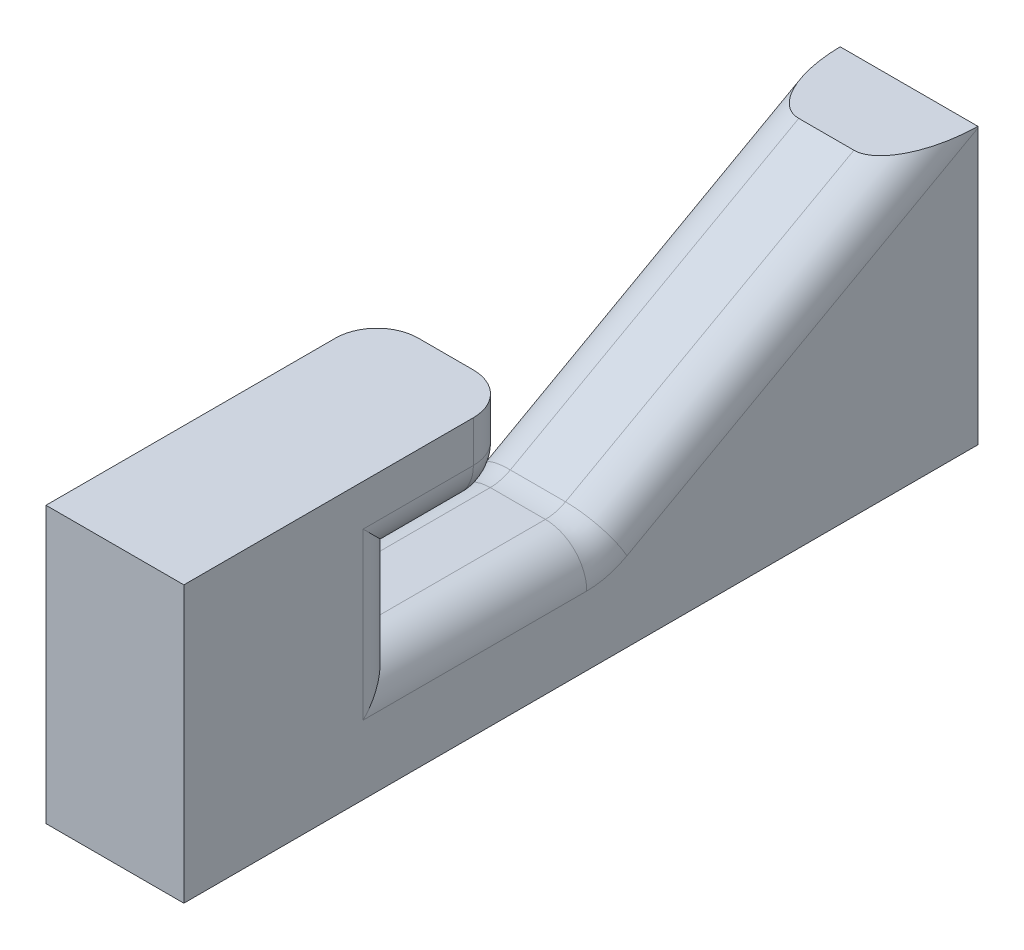
from build123d import *

# Parameters (mm, degrees)
SKETCH2_W           = 10
SKETCH2_H           = 28.8
BOSS_EXTRUDE1_DEPTH = 5
CUT_EXTRUDE1_DEPTH  = 31.894012365
FILLET2_R           = 1.5


with BuildPart() as part:
    # Sketch2 → Boss-Extrude1 (new body)
    with BuildSketch(Plane.YZ):
        with Locations((5, 14.4)):
            Rectangle(SKETCH2_W, SKETCH2_H)
    extrude(amount=BOSS_EXTRUDE1_DEPTH)

    # Sketch3 → Cut-Extrude1 (cut, through all)
    with BuildSketch(Plane.YZ.offset(5)):
        Polygon((10, 16.8), (7, 16.8), (7, 20.8), (4, 20.8), (4, 13.8), (10, 3), align=None)
    extrude(amount=-CUT_EXTRUDE1_DEPTH, mode=Mode.SUBTRACT)

    # Fillet2
    fillet2_edges = [part.edges().sort_by_distance(p)[0] for p in [
        (2.5, 7, 16.8),
        (5, 7, 18.8),
        (5, 4, 17.3),
        (5, 5.5, 20.8),
        (0, 4, 17.3),
        (0, 5.5, 20.8),
        (0, 7, 18.8),
        (0, 7, 8.4),
        (5, 7, 8.4),
        (2.5, 4, 13.8),
        (0, 8.5, 16.8),
        (5, 8.5, 16.8),
    ]]
    fillet(fillet2_edges, radius=FILLET2_R)


solid = part.part
